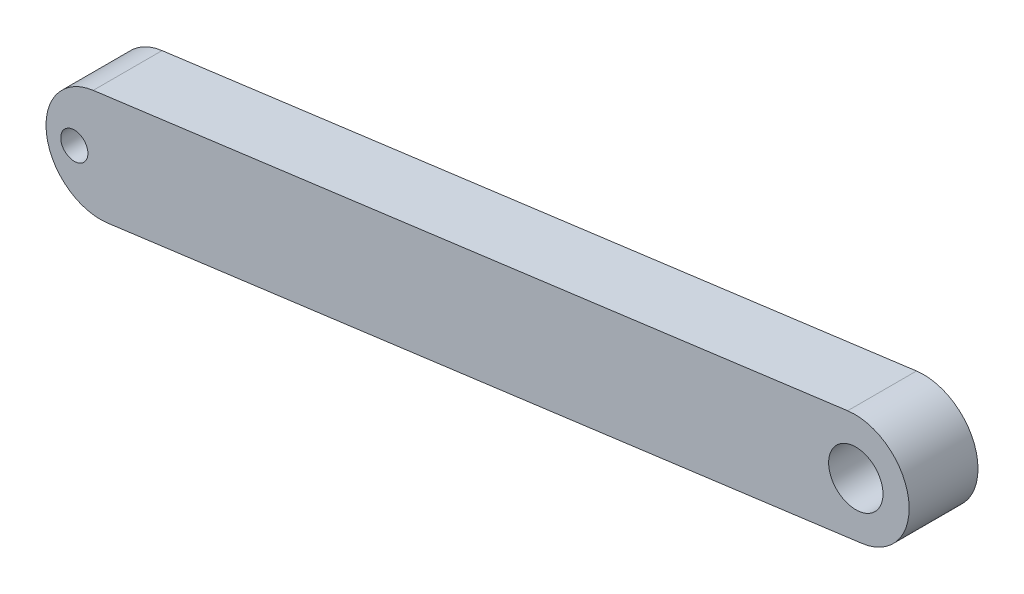
from build123d import *

# Parameters (mm, degrees)
BOSS_EXTRUDE1_DEPTH = 380
SKETCH2_R           = 150
CUT_EXTRUDE1_DEPTH  = 5468.121457782
SKETCH4_R           = 75
CUT_EXTRUDE2_DEPTH  = 5468.121457782


with BuildPart() as part:
    # Sketch1 → Boss-Extrude1 (new body)
    with BuildSketch(Plane.XY):
        with BuildLine():
            Line((4764.45194236, -774.716056977), (600.686121492, -1325.219634596))
            ThreePointArc((600.686121492, -1325.219634596), (342.59596126, -1661.95316306), (679.329489724, -1920.043323292))
            Line((679.329489724, -1920.043323292), (4843.095310591, -1369.539745672))
            ThreePointArc((4843.095310591, -1369.539745672), (5101.185470824, -1032.806217209), (4764.45194236, -774.716056977))
        make_face()
    extrude(amount=BOSS_EXTRUDE1_DEPTH)

    # Sketch2 → Cut-Extrude1 (cut, through all)
    with BuildSketch(Plane.XY.offset(380)):
        with Locations((4809.308774546, -1075.475725569)):
            Circle(SKETCH2_R)
    extrude(amount=-CUT_EXTRUDE1_DEPTH, mode=Mode.SUBTRACT)

    # Sketch4 → Cut-Extrude2 (cut, through all)
    with BuildSketch(Plane.XY.offset(380)):
        with Locations((496.308780647, -1641.630344573)):
            Circle(SKETCH4_R)
    extrude(amount=-CUT_EXTRUDE2_DEPTH, mode=Mode.SUBTRACT)


solid = part.part
